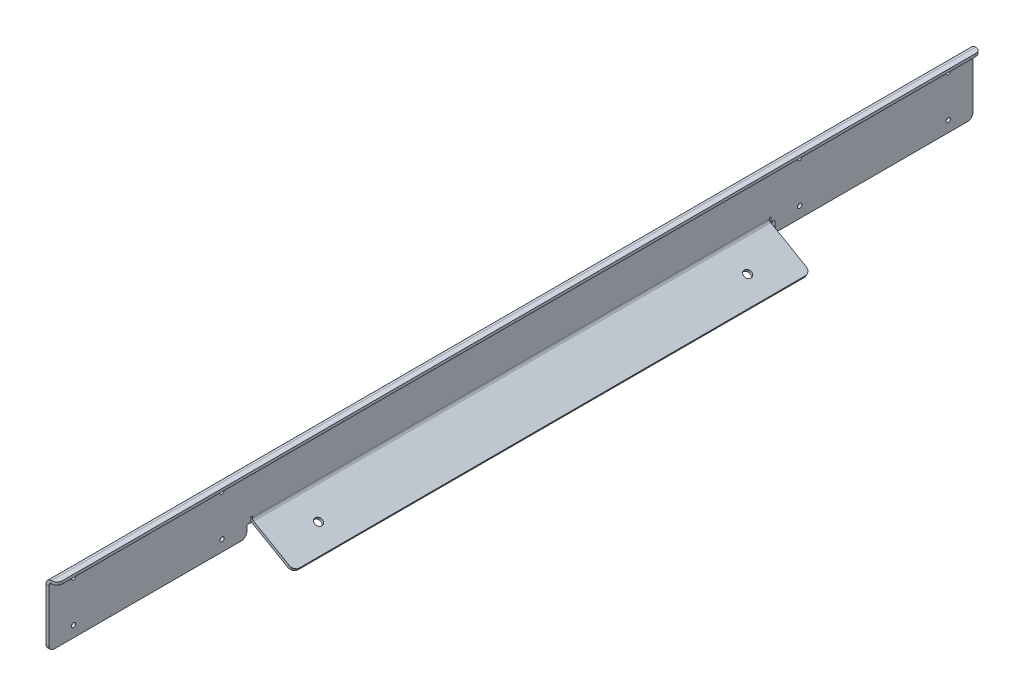
from build123d import *

# Parameters (mm, degrees)
BASE_FLANGE1_DEPTH           = 3.175
EDGE_FLANGE1_START           = -833.4375
EDGE_FLANGE1_DEPTH           = 600.075
EDGE_FLANGE1_2_DEPTH         = 1.5875
EDGE_FLANGE1_START_2         = -234.95
EDGE_FLANGE1_3_DEPTH         = 1.5875
EDGE_FLANGE1_START_3         = -831.85
EDGE_FLANGE1_4_DEPTH         = 596.9
SKETCH10_R                   = 4.3688
CUT_EXTRUDE1_DEPTH           = 1070.608165207
SKETCH11_R                   = 2.45745
CUT_EXTRUDE2_DEPTH           = 1071.515830826
EDGE_FLANGE2_STRIP_W         = 19.05
EDGE_FLANGE2_STRIP_H         = 3.175
EDGE_FLANGE2_STRIP_CUT_DEPTH = 1066.8
EDGE_FLANGE2_DEPTH           = 1066.8
FILLET1_R                    = 6.35


# Read off the part's stored shape, not the designer's step: Edge-Flange1
# Sheet-metal steps are written as plain solids
with BuildPart() as part:
    # Sketch1 → Base-Flange1 (new body)
    with BuildSketch(Plane(origin=(0, 0, 0), x_dir=(0, 0, -1), z_dir=(1, 0, 0))):
        Polygon((838.2, 0), (1066.8, 0), (1066.8, 73.025), (0, 73.025), (0, 0), (228.6, 0), (228.6, 12.7), (234.95, 12.7), (234.95, 11.43), (831.85, 11.43), (831.85, 12.7), (838.2, 12.7), align=None)
    extrude(amount=-BASE_FLANGE1_DEPTH)

    # Edge-Flange1 outline → Edge-Flange1 (cut)
    with BuildSketch(Plane.XY.offset(EDGE_FLANGE1_START)):
        with BuildLine():
            Line((-3.175, 16.929261314), (-3.175, 11.43))
            Line((-3.175, 11.43), (0, 11.43))
            ThreePointArc((0, 11.43), (-2.324261314, 13.754261314), (-3.175, 16.929261314))
        make_face()
    extrude(amount=EDGE_FLANGE1_DEPTH, mode=Mode.SUBTRACT)

    # Edge-Flange1 2 outline → Edge-Flange1 2 (cut)
    with BuildSketch(Plane.XY.offset(EDGE_FLANGE1_START)):
        with BuildLine():
            Line((0, 18.516761314), (-3.175, 18.516761314))
            Line((-3.175, 18.516761314), (-3.175, 16.929261314))
            ThreePointArc((-3.175, 16.929261314), (-2.757968249, 14.665992052), (-1.561649527, 12.7))
            Line((-1.561649527, 12.7), (0, 12.7))
            Line((0, 12.7), (0, 18.516761314))
        make_face()
    extrude(amount=EDGE_FLANGE1_2_DEPTH, mode=Mode.SUBTRACT)

    # Edge-Flange1 3 outline → Edge-Flange1 3 (cut)
    with BuildSketch(Plane.XY.offset(EDGE_FLANGE1_START_2)):
        with BuildLine():
            Line((0, 18.516761314), (-3.175, 18.516761314))
            Line((-3.175, 18.516761314), (-3.175, 16.929261314))
            ThreePointArc((-3.175, 16.929261314), (-2.757968249, 14.665992052), (-1.561649527, 12.7))
            Line((-1.561649527, 12.7), (0, 12.7))
            Line((0, 12.7), (0, 18.516761314))
        make_face()
    extrude(amount=EDGE_FLANGE1_3_DEPTH, mode=Mode.SUBTRACT)

    # Edge-Flange1 4 outline → Edge-Flange1 4 (add)
    with BuildSketch(Plane.XY.offset(EDGE_FLANGE1_START_3)):
        with BuildLine():
            ThreePointArc((1.5875, 14.179630657), (0.425369343, 15.341761314), (0, 16.929261314))
            Line((0, 16.929261314), (0, 11.43))
            Line((0, 11.43), (46.318351826, -15.311912895))
            Line((46.318351826, -15.311912895), (47.905851826, -12.562282238))
            Line((47.905851826, -12.562282238), (1.5875, 14.179630657))
        make_face()
    extrude(amount=EDGE_FLANGE1_4_DEPTH)

    # Sketch10 → Cut-Extrude1 (cut, through all)
    with BuildSketch(Plane(origin=(4.949335183, 8.5725, 0), x_dir=(0.8660254037844364, -0.5000000000000041, 0), z_dir=(-0.500000000000004, -0.8660254037844363, 0))):
        with Locations((22.112285791, -285.75)):
            Circle(SKETCH10_R)
        with Locations((22.112285791, -781.05)):
            Circle(SKETCH10_R)
    extrude(amount=-CUT_EXTRUDE1_DEPTH, mode=Mode.SUBTRACT)

    # Sketch11 → Cut-Extrude2 (cut, through all)
    with BuildSketch(Plane.ZY.offset(3.175)):
        with Locations((-1038.225, 60.325)):
            Circle(SKETCH11_R)
        with Locations((-866.775, 60.325)):
            Circle(SKETCH11_R)
        with Locations((-1038.225, 12.7)):
            Circle(SKETCH11_R)
        with Locations((-866.775, 12.7)):
            Circle(SKETCH11_R)
        with Locations((-200.025, 60.325)):
            Circle(SKETCH11_R)
        with Locations((-200.025, 12.7)):
            Circle(SKETCH11_R)
        with Locations((-28.575, 12.7)):
            Circle(SKETCH11_R)
        with Locations((-28.575, 60.325)):
            Circle(SKETCH11_R)
    extrude(amount=-CUT_EXTRUDE2_DEPTH, mode=Mode.SUBTRACT)

    # Edge-Flange2 strip (across the edge) → Edge-Flange2 strip cut (cut)
    with BuildSketch(Plane(origin=(0, 73.025, -1066.8), x_dir=(0, -1, 0), z_dir=(0, 0, 1))):
        with Locations((-3.175, -1.5875)):
            Rectangle(EDGE_FLANGE2_STRIP_W, EDGE_FLANGE2_STRIP_H)
    extrude(amount=EDGE_FLANGE2_STRIP_CUT_DEPTH, mode=Mode.SUBTRACT)

    # Edge-Flange2 section (across the edge) → Edge-Flange2 (add)
    with BuildSketch(Plane(origin=(0, 73.025, -1066.8), x_dir=(0, -1, 0), z_dir=(0, 0, 1))):
        with BuildLine():
            Line((0, 3.175), (0, 9.525))
            Line((0, 9.525), (3.175, 9.525))
            Line((3.175, 9.525), (3.175, 3.175))
            ThreePointArc((3.175, 3.175), (4.10493597, 0.92993597), (6.35, 0))
            Line((6.35, 0), (6.35, -3.175))
            ThreePointArc((6.35, -3.175), (1.859871939, -1.315128061), (0, 3.175))
        make_face()
    extrude(amount=EDGE_FLANGE2_DEPTH)

    # Fillet1
    fillet1_edges = [part.edges().sort_by_distance(p)[0] for p in [
        (-1.5875, 0, 0),
        (47.112101826, -13.937097567, -234.95),
        (-1.5875, 0, -228.6),
        (47.112101826, -13.937097567, -831.85),
        (-1.5875, 0, -838.2),
        (-1.5875, 0, -1066.8),
        (9.525, 71.4375, 0),
        (9.525, 71.4375, -1066.8),
    ]]
    fillet(fillet1_edges, radius=FILLET1_R)


solid = part.part
